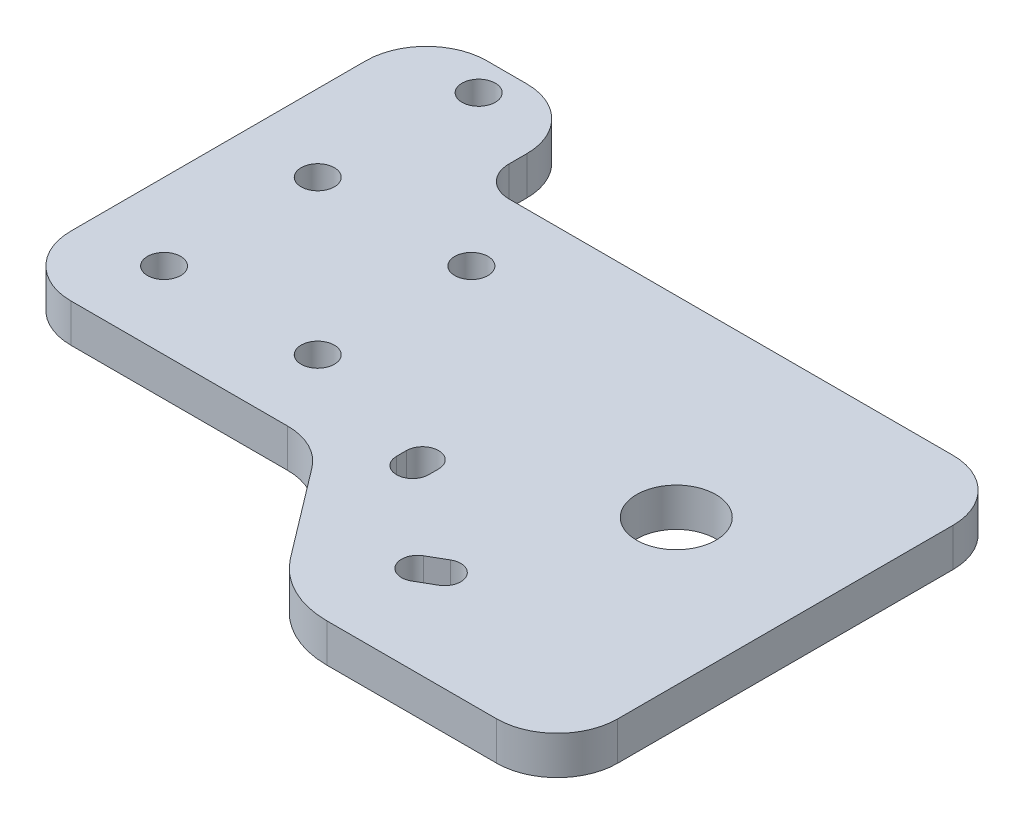
from build123d import *

# Parameters (mm, degrees)
BOSS_EXTRUDE1_DEPTH  = 6.35
M5_CLEARANCE_HOLE1_D = 5.5
CUT_EXTRUDE2_DEPTH   = 103.841068434
FILLET1_R            = 10
SKETCH10_R           = 6.55
CUT_EXTRUDE3_DEPTH   = 103.841068434
FILLET2_R            = 5


with BuildPart() as part:
    # Sketch1 → Boss-Extrude1 (new body)
    with BuildSketch(Plane(origin=(0, 0, 0), x_dir=(1, 0, 0), z_dir=(0, 1, 0))):
        with BuildLine():
            Line((25.4, -25.4), (-25.4, -25.4))
            Line((-25.4, -25.4), (-25.4, 25.4))
            Line((-25.4, 25.4), (-25.4, 43.35))
            Line((-25.4, 43.35), (1.2, 43.35))
            Line((1.2, 43.35), (1.2, 25.4))
            Line((1.2, 25.4), (25.4, 25.4))
            Line((25.4, 25.4), (89.621209859, 25.4))
            Line((89.621209859, 25.4), (89.621209859, -50.04))
            Line((89.621209859, -50.04), (51.541941751, -50.04))
            ThreePointArc((51.541941751, -50.04), (44.870841587, -48.474895705), (39.591870426, -44.10618968))
            Line((39.591870426, -44.10618968), (25.4, -25.4))
        make_face()
    extrude(amount=BOSS_EXTRUDE1_DEPTH)

    # M5 Clearance Hole1 (through all)
    with Locations(Plane(origin=(0, 6.35, 0), x_dir=(1, 0, 0), z_dir=(0, 1, 0))):
        with Locations((-12.7, 12.7), (12.7, 12.7), (12.7, -12.7), (-12.7, -12.7), (-11.5, 38.1)):
            Hole(M5_CLEARANCE_HOLE1_D / 2)

    # Sketch7 → Cut-Extrude2 (cut, through all)
    with BuildSketch(Plane(origin=(0, 6.35, 0), x_dir=(1, 0, 0), z_dir=(0, 1, 0))):
        with BuildLine():
            Line((53.051764766, -31.105892862), (50.215452987, -32.745892862))
            ThreePointArc((50.215452987, -32.745892862), (49.247834614, -36.366488764), (52.868430515, -37.334107138))
            Line((52.868430515, -37.334107138), (55.704742294, -35.694107138))
            ThreePointArc((55.704742294, -35.694107138), (56.672360668, -32.073511236), (53.051764766, -31.105892862))
        make_face()
        with BuildLine():
            Line((33.75, -19.08), (33.75, -20.72))
            ThreePointArc((33.75, -20.72), (36.4, -23.37), (39.05, -20.72))
            Line((39.05, -20.72), (39.05, -19.08))
            ThreePointArc((39.05, -19.08), (36.4, -16.43), (33.75, -19.08))
        make_face()
    extrude(amount=-CUT_EXTRUDE2_DEPTH, mode=Mode.SUBTRACT)

    # Fillet1
    fillet1_edges = [part.edges().sort_by_distance(p)[0] for p in [
        (89.621209859, 3.175, 50.04),
        (89.621209859, 3.175, -25.4),
        (25.4, 3.175, 25.4),
        (-25.4, 3.175, 25.4),
        (-25.4, 3.175, -43.35),
        (1.2, 3.175, -43.35),
    ]]
    fillet(fillet1_edges, radius=FILLET1_R)

    # Sketch10 → Cut-Extrude3 (cut, through all)
    with BuildSketch(Plane(origin=(0, 6.35, 0), x_dir=(1, 0, 0), z_dir=(0, 1, 0))):
        with Locations((65.621209859, -6.36)):
            Circle(SKETCH10_R)
    extrude(amount=-CUT_EXTRUDE3_DEPTH, mode=Mode.SUBTRACT)

    # Fillet2
    fillet2_edges = [part.edges().sort_by_distance(p)[0] for p in [
        (1.2, 3.175, -25.4),
    ]]
    fillet(fillet2_edges, radius=FILLET2_R)


solid = part.part
